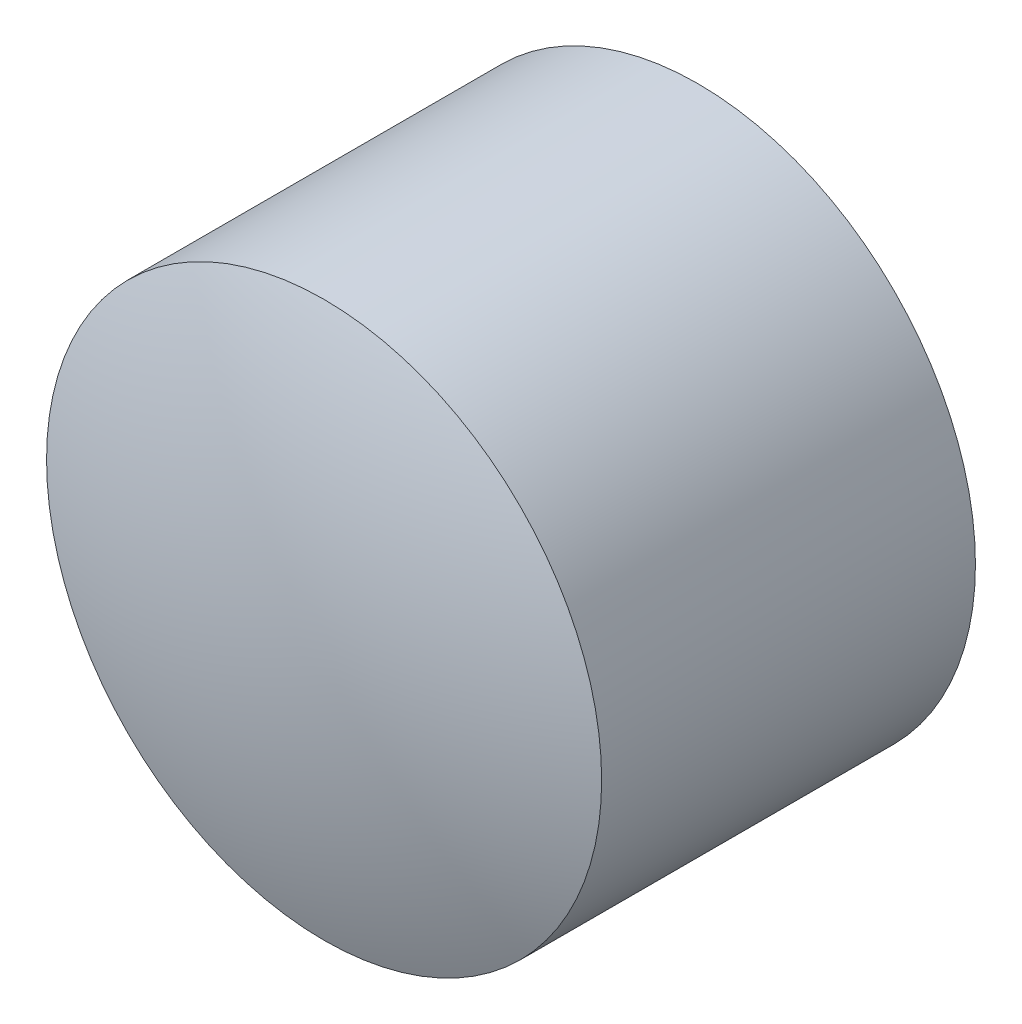
from build123d import *


with BuildPart() as part:
    # Sketch3 → Revolve1 (revolve)
    with BuildSketch(Plane(origin=(0, 0, 0), x_dir=(0, 0, -1), z_dir=(1, 0, 0))):
        with BuildLine():
            ThreePointArc((-1.325790464, 0), (-0.9851724, 2.047763741), (0, 3.875))
            Line((0, 3.875), (-5.218697034, 3.875))
            ThreePointArc((-5.218697034, 3.875), (-5.749764973, 1.96975813), (-5.928741651, 0))
            Line((-5.928741651, 0), (-1.325790464, 0))
        make_face()
    revolve(axis=Axis((0, 0, 0), (0, 0, 1)))


solid = part.part
